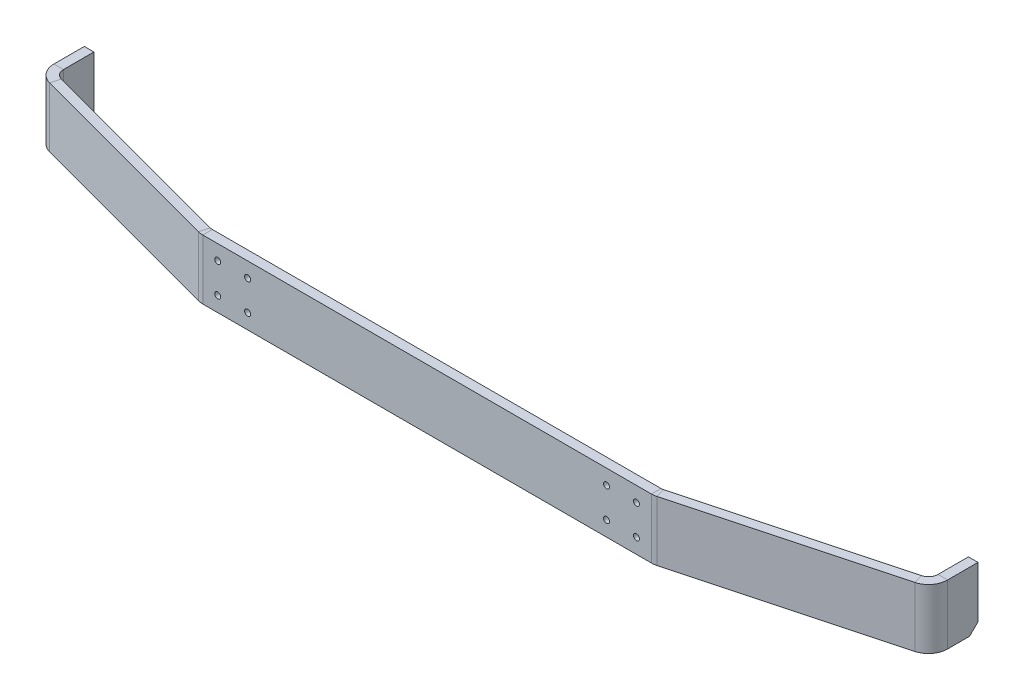
from build123d import *

# Parameters (mm, degrees)
SM_BASE_FLANGE_2_DEPTH = 25
M6X1_01_D              = 5
M6X1_01_CSINK_D        = 6.5
M6X1_01_CSINK_ANGLE    = 90
CHAMFER_1_SIZE         = 7


# Sheet-metal steps are written as plain solids
with BuildPart() as part:
    # Sketch 2 → Базовая кромка2 (new, symmetric)
    with BuildSketch(Plane(origin=(0, 0, 0), x_dir=(1, 0, 0), z_dir=(0, 1, 0))):
        with BuildLine():
            Line((-365.5, 87), (-365.5, 61.551362713))
            ThreePointArc((-365.5, 61.551362713), (-363.846826722, 56.681271281), (-359.570552361, 53.823956103))
            Line((-359.570552361, 53.823956103), (-189.570552361, 8.27259339))
            ThreePointArc((-189.570552361, 8.27259339), (-188.544209538, 8.068441109), (-187.5, 8))
            Line((-187.5, 8), (187.5, 8))
            ThreePointArc((187.5, 8), (188.544209538, 8.068441109), (189.570552361, 8.27259339))
            Line((189.570552361, 8.27259339), (359.570552361, 53.823956103))
            ThreePointArc((359.570552361, 53.823956103), (363.846826722, 56.681271281), (365.5, 61.551362713))
            Line((365.5, 61.551362713), (365.5, 87))
            Line((365.5, 87), (373.5, 87))
            Line((373.5, 87), (373.5, 61.551362713))
            ThreePointArc((373.5, 61.551362713), (370.193653445, 51.811179849), (361.641104722, 46.096549493))
            Line((361.641104722, 46.096549493), (191.641104722, 0.545186779))
            ThreePointArc((191.641104722, 0.545186779), (189.588419076, 0.136882218), (187.5, 0))
            Line((187.5, 0), (-187.5, 0))
            ThreePointArc((-187.5, 0), (-189.588419076, 0.136882218), (-191.641104722, 0.545186779))
            Line((-191.641104722, 0.545186779), (-361.641104722, 46.096549493))
            ThreePointArc((-361.641104722, 46.096549493), (-370.193653445, 51.811179849), (-373.5, 61.551362713))
            Line((-373.5, 61.551362713), (-373.5, 87))
            Line((-373.5, 87), (-365.5, 87))
        make_face()
    extrude(amount=SM_BASE_FLANGE_2_DEPTH, both=True)

    # Отверстие обработанное метчиком M6x1.01 (through all)
    with Locations(Plane(origin=(175, 12.5, -8), x_dir=(-1, 0, 0), z_dir=(0, 0, -1))):
        with Locations((0, 0), (25, 0), (25, -25), (0, -25), (325, 0), (350, 0), (350, -25), (325, -25)):
            CounterSinkHole(M6X1_01_D / 2, M6X1_01_CSINK_D / 2, counter_sink_angle=M6X1_01_CSINK_ANGLE)

    # Фаска1
    chamfer_1_edges = [part.edges().sort_by_distance(p)[0] for p in [
        (369.5, -25, -87),
        (-369.5, -25, -87),
    ]]
    chamfer(chamfer_1_edges, length=CHAMFER_1_SIZE)


solid = part.part
